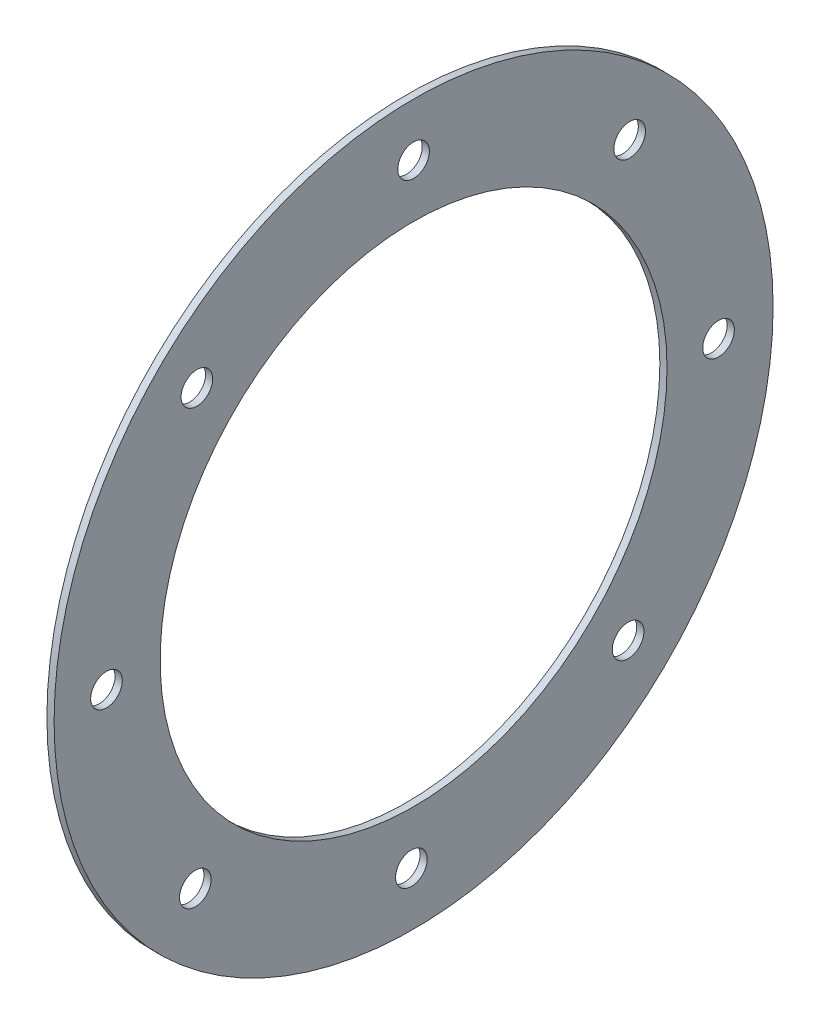
from build123d import *

# Parameters (mm, degrees)
SKETCH_1_R      = 100
SKETCH_1_R_2    = 70.5
SKETCH_1_R_3    = 4.4
EXTRUDE_1_DEPTH = 2


with BuildPart() as part:
    # Эскиз1 → Бобышка-Вытянуть1 (new body)
    with BuildSketch(Plane(origin=(0, 0, 0), x_dir=(0, 0, -1), z_dir=(1, 0, 0))):
        Circle(SKETCH_1_R)
        Circle(SKETCH_1_R_2, mode=Mode.SUBTRACT)
        with Locations((0, 85.25)):
            Circle(SKETCH_1_R_3, mode=Mode.SUBTRACT)
        with Locations((60.104076401, 60.104076401)):
            Circle(SKETCH_1_R_3, mode=Mode.SUBTRACT)
        with Locations((84.823223305, -0.176776695)):
            Circle(SKETCH_1_R_3, mode=Mode.SUBTRACT)
        with Locations((59.677299706, -60.280853096)):
            Circle(SKETCH_1_R_3, mode=Mode.SUBTRACT)
        with Locations((-0.603553391, -85)):
            Circle(SKETCH_1_R_3, mode=Mode.SUBTRACT)
        with Locations((-60.707629791, -59.854076401)):
            Circle(SKETCH_1_R_3, mode=Mode.SUBTRACT)
        with Locations((-85.426776695, 0.426776695)):
            Circle(SKETCH_1_R_3, mode=Mode.SUBTRACT)
        with Locations((-60.280853096, 60.530853096)):
            Circle(SKETCH_1_R_3, mode=Mode.SUBTRACT)
    extrude(amount=EXTRUDE_1_DEPTH)


solid = part.part
